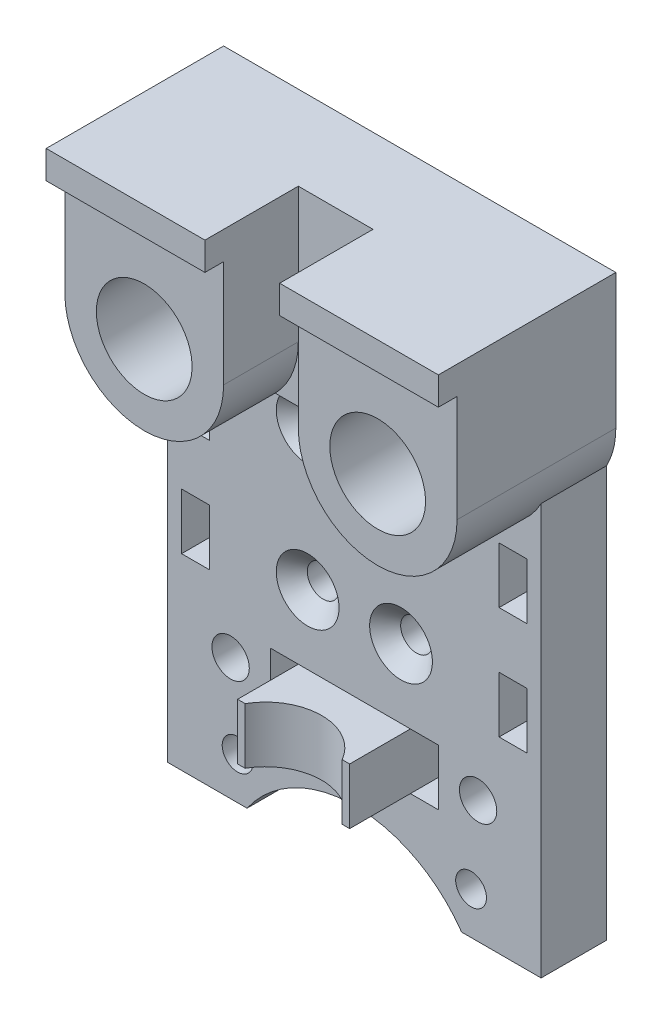
from build123d import *
from build123d.topology import SkipClean

# Parameters (mm, degrees)
SKETCH1_W                         = 30
SKETCH1_H                         = 42
BOSS_EXTRUDE1_DEPTH               = 7
CSK_FOR_M3_SFHCS1_D               = 3.4
CSK_FOR_M3_SFHCS1_CSINK_D         = 6.72
CSK_FOR_M3_SFHCS1_CSINK_ANGLE     = 90
SKETCH4_R                         = 14
CUT_EXTRUDE1_DEPTH                = 10
M4X0_7_TAPPED_HOLE1_D             = 3.3
SKETCH8_W                         = 12
SKETCH8_H                         = 6
BOSS_EXTRUDE2_DEPTH               = 6.5
SKETCH9_R                         = 6
CUT_EXTRUDE2_DEPTH                = 10
SKETCH13_W                        = 3
SKETCH13_H                        = 6
CUT_EXTRUDE4_DEPTH                = 10
BOSS_EXTRUDE5_DEPTH               = 10
BOSS_EXTRUDE5_DEPTH_BACK          = 7
SKETCH14_W                        = 48
SKETCH14_H                        = 17
SKETCH15_R                        = 5.125
CUT_EXTRUDE5_DEPTH                = 52.273774973
BOSS_EXTRUDE6_REACH               = 53.274
SKETCH16_R                        = 8.5
SKETCH16_R_2                      = 5.125
SKETCH18_R                        = 5.75
SKETCH18_R_2                      = 1.75
BOSS_EXTRUDE7_DEPTH               = 6.5
SKETCH19_R                        = 1.75
CUT_EXTRUDE6_DEPTH                = 17
SKETCH20_W                        = 32
SKETCH20_H                        = 3
BOSS_EXTRUDE8_DEPTH               = 3
CUT_EXTRUDE7_DEPTH                = 8
CUT_EXTRUDE7_DEPTH_BACK           = 8
SKETCH22_R                        = 1.75
SKETCH22_W                        = 8
SKETCH22_H                        = 3
SKETCH24_W                        = 2
SKETCH24_H                        = 7.001
F_4_0_4_DIAMETER_HOLE1_AT_2_COUNT = 2
F_4_0_4_DIAMETER_HOLE1_AT_2_PITCH = 26.5
CUT_EXTRUDE8_DEPTH                = 17
MOVE_FACE2_BY                     = 0.43
SKETCH26_W                        = 32
SKETCH26_H                        = 3.43
CUT_EXTRUDE9_DEPTH                = 3
BOSS_EXTRUDE9_DEPTH               = 3
DELETEFACE1_START                 = -7
DELETEFACE1_DEPTH                 = 7
SKETCH28_W                        = 3
SKETCH28_H                        = 6
CUT_EXTRUDE10_DEPTH               = 49.859492425


# Read off the part's stored shape, not the designer's step: DeleteFace1
with BuildPart() as part:
    # Sketch1 → Boss-Extrude1 (new body)
    with BuildSketch(Plane.XY):
        with Locations((0, -21)):
            Rectangle(SKETCH1_W, SKETCH1_H)
        Polygon((-15, -42), (-15, -2), (-20, -7), (-20, -42), align=None)
        Polygon((15, -2), (15, -42), (20, -42), (20, -7), align=None)
    extrude(amount=-BOSS_EXTRUDE1_DEPTH)

    # CSK for M3 SFHCS1 (through all)
    with Locations(Plane.XY):
        with Locations((-5, -3.5), (5, -3.5), (-5, -18.5), (5, -18.5)):
            CounterSinkHole(CSK_FOR_M3_SFHCS1_D / 2, CSK_FOR_M3_SFHCS1_CSINK_D / 2, counter_sink_angle=CSK_FOR_M3_SFHCS1_CSINK_ANGLE)

    # Sketch4 → Cut-Extrude1 (cut)
    with BuildSketch(Plane.XY):
        with Locations((0, -50)):
            Circle(SKETCH4_R)
    extrude(amount=-CUT_EXTRUDE1_DEPTH, mode=Mode.SUBTRACT)

    # M4x0.7 Tapped Hole1 (through all)
    with Locations(Plane.XY):
        with Locations((-12.5, -37.5), (12.5, -37.5)):
            Hole(M4X0_7_TAPPED_HOLE1_D / 2)

    # Sketch8 → Boss-Extrude2 (add)
    with BuildSketch(Plane.XY):
        with Locations((0, -28.9)):
            Rectangle(SKETCH8_W, SKETCH8_H)
    extrude(amount=BOSS_EXTRUDE2_DEPTH)

    # Sketch9 → Cut-Extrude2 (cut)
    with BuildSketch(Plane(origin=(0, -25.9, 0), x_dir=(1, 0, 0), z_dir=(0, 1, 0))):
        with Locations((0, -9.5)):
            Circle(SKETCH9_R)
    extrude(amount=-CUT_EXTRUDE2_DEPTH, mode=Mode.SUBTRACT)

    # Sketch13 → Cut-Extrude4 (cut)
    with BuildSketch(Plane.XY):
        with Locations((-7.5, -28.9)):
            Rectangle(SKETCH13_W, SKETCH13_H)
        with Locations((7.5, -28.9)):
            Rectangle(SKETCH13_W, SKETCH13_H)
    extrude(amount=-CUT_EXTRUDE4_DEPTH, mode=Mode.SUBTRACT)

    # Sketch14 → Boss-Extrude5 (add, two sides: drawn at the far end of the back side and taken through both)
    with BuildSketch(Plane.XY.offset(-BOSS_EXTRUDE5_DEPTH_BACK)):
        with Locations((0, 8.5)):
            Rectangle(SKETCH14_W, SKETCH14_H)
    extrude(amount=BOSS_EXTRUDE5_DEPTH + BOSS_EXTRUDE5_DEPTH_BACK)

    # Sketch15 → Cut-Extrude5 (cut, through all)
    with BuildSketch(Plane(origin=(0, 0, -7), x_dir=(-1, 0, 0), z_dir=(0, 0, -1))):
        with Locations((12.5, 6)):
            Circle(SKETCH15_R)
        with Locations((-12.5, 6)):
            Circle(SKETCH15_R)
    extrude(amount=-CUT_EXTRUDE5_DEPTH, mode=Mode.SUBTRACT)

    # Boss-Extrude6: up to this face of the body (flat: up to its plane)
    boss_extrude6_end = Plane(part.part.faces().sort_by_distance((0, -11.103380249, -7))[0])
    # Sketch16 → Boss-Extrude6 (add, up to the picked face)
    with BuildSketch(Plane.XY.offset(10), mode=Mode.PRIVATE) as boss_extrude6_sk1:
        with Locations((-12.5, 6)):
            Circle(SKETCH16_R)
        with Locations(Location((-12.5, 6, 0), (0, 0, 180))):
            Circle(SKETCH16_R_2, mode=Mode.SUBTRACT)
    boss_extrude6_tool1 = split(extrude(boss_extrude6_sk1.sketch, amount=-BOSS_EXTRUDE6_REACH, mode=Mode.PRIVATE), bisect_by=boss_extrude6_end, keep=Keep.BOTH, mode=Mode.PRIVATE)
    # Sketch16 → Boss-Extrude6 (add, up to the picked face)
    with BuildSketch(Plane.XY.offset(10), mode=Mode.PRIVATE) as boss_extrude6_sk2:
        with Locations((12.5, 6)):
            Circle(SKETCH16_R)
        with Locations(Location((12.5, 6, 0), (0, 0, 180))):
            Circle(SKETCH16_R_2, mode=Mode.SUBTRACT)
    boss_extrude6_tool2 = split(extrude(boss_extrude6_sk2.sketch, amount=-BOSS_EXTRUDE6_REACH, mode=Mode.PRIVATE), bisect_by=boss_extrude6_end, keep=Keep.BOTH, mode=Mode.PRIVATE)
    add(boss_extrude6_tool1.solids().sort_by(Axis((-20.759584, 6, 10), (0, 0, -1)))[0])
    add(boss_extrude6_tool2.solids().sort_by(Axis((4.240416, 6, 10), (0, 0, -1)))[0])

    # Sketch19 → Cut-Extrude6 (cut)
    with BuildSketch(Plane(origin=(0, 0, -7), x_dir=(-1, 0, 0), z_dir=(0, 0, -1))):
        with Locations(Location((0, 5.25, 0), (0, 0, 180))):
            Circle(SKETCH19_R)
    extrude(amount=-CUT_EXTRUDE6_DEPTH, mode=Mode.SUBTRACT)

    # Sketch20 → Boss-Extrude8 (add)
    with BuildSketch(Plane.XY.offset(10)):
        with Locations((0, 15.5)):
            Rectangle(SKETCH20_W, SKETCH20_H)
    extrude(amount=BOSS_EXTRUDE8_DEPTH)

    # Sketch22 → Cut-Extrude7 (cut, two sides: drawn at the far end of the back side and taken through both)
    # profile 1 of 4: a face of its own
    with SkipClean():  # the faces are left unmerged after this step: merging them gives an invalid solid
        with BuildSketch(Plane.XY.offset(10).offset(-CUT_EXTRUDE7_DEPTH_BACK)):
            Polygon((-4, 6), (-4, 0), (4, 0), (4, 6), (4, 14), (-4, 14), align=None)
            with Locations((0, 5.25)):
                Circle(SKETCH22_R, mode=Mode.SUBTRACT)
        # profile 2 of 4: a face of its own
        with BuildSketch(Plane.XY.offset(10).offset(-CUT_EXTRUDE7_DEPTH_BACK)):
            with BuildLine():
                Line((-6.479202711, 0), (-4, 0))
                Line((-4, 0), (-4, 6))
                ThreePointArc((-4, 6), (-4.644213058, 2.753985287), (-6.479202711, 0))
            make_face()
        # profile 3 of 4: a face of its own
        with BuildSketch(Plane.XY.offset(10).offset(-CUT_EXTRUDE7_DEPTH_BACK)):
            with BuildLine():
                Line((4, 6), (4, 0))
                Line((4, 0), (6.479202711, 0))
                ThreePointArc((6.479202711, 0), (4.644213058, 2.753985287), (4, 6))
            make_face()
        # profile 4 of 4: a face of its own
        with BuildSketch(Plane.XY.offset(10).offset(-CUT_EXTRUDE7_DEPTH_BACK)):
            with Locations((0, 15.5)):
                Rectangle(SKETCH22_W, SKETCH22_H)
        extrude(amount=CUT_EXTRUDE7_DEPTH + CUT_EXTRUDE7_DEPTH_BACK, mode=Mode.SUBTRACT)

    # Sketch24 → Ø4.0 (4) Diameter Hole1 (revolve, cut)
    with SkipClean():  # the faces are left unmerged after this step: merging them gives an invalid solid
        with BuildSketch(Plane(origin=(13.25, -28.9, -7), x_dir=(0, 1, 0), z_dir=(1, 0, 0))):
            with Locations((1, 3.5005)):
                Rectangle(SKETCH24_W, SKETCH24_H)
        f_4_0_4_diameter_hole1 = revolve(axis=Axis((13.25, -28.9, -13.35), (0, 0, 1)), mode=Mode.SUBTRACT)

    # Ø4.0 (4) Diameter Hole1 at 2: Ø4.0 (4) Diameter Hole1 ×2
    with SkipClean():  # the faces are left unmerged after this step: merging them gives an invalid solid
        with Locations(*[(-i * F_4_0_4_DIAMETER_HOLE1_AT_2_PITCH, 0, 0) for i in range(1, F_4_0_4_DIAMETER_HOLE1_AT_2_COUNT)]):
            add(f_4_0_4_diameter_hole1, mode=Mode.SUBTRACT)

    # Sketch25 → Cut-Extrude8 (cut)
    with SkipClean():  # the faces are left unmerged after this step: merging them gives an invalid solid
        with BuildSketch(Plane.XY.offset(10)):
            with BuildLine():
                ThreePointArc((-18.520797289, 0), (-20.355786942, 2.753985287), (-21, 6))
                Line((-21, 6), (-21, 17))
                Line((-21, 17), (-24, 17))
                Line((-24, 17), (-24, 0))
                Line((-24, 0), (-18.520797289, 0))
            make_face()
            with BuildLine():
                ThreePointArc((21, 6), (20.355786942, 2.753985287), (18.520797289, 0))
                Line((18.520797289, 0), (24, 0))
                Line((24, 0), (24, 17))
                Line((24, 17), (21, 17))
                Line((21, 17), (21, 6))
            make_face()
        extrude(amount=-CUT_EXTRUDE8_DEPTH, mode=Mode.SUBTRACT)

    # Move Face2: a face moved outward by 0.43
    extrude(part.faces().sort_by_distance((0, 17, -2))[0], amount=MOVE_FACE2_BY, dir=(0, 1, 0))

    # Sketch26 → Cut-Extrude9 (cut)
    with SkipClean():  # the faces are left unmerged after this step: merging them gives an invalid solid
        with BuildSketch(Plane.XY.offset(13)):
            with Locations((0, 15.715)):
                Rectangle(SKETCH26_W, SKETCH26_H)
        extrude(amount=-CUT_EXTRUDE9_DEPTH, mode=Mode.SUBTRACT)

    # Sketch27 → Boss-Extrude9 (add)
    with SkipClean():  # the faces are left unmerged after this step: merging them gives an invalid solid
        with BuildSketch(Plane(origin=(0, 17.43, 0), x_dir=(1, 0, 0), z_dir=(0, 1, 0))):
            Polygon((-21, -10), (-21, -12), (-4, -12), (-4, -10), (-4, -2), (4, -2), (4, -10), (4, -12), (21, -12), (21, -10), (21, 7), (-21, 7), align=None)
        extrude(amount=BOSS_EXTRUDE9_DEPTH)

    # DeleteFace1 outline → DeleteFace1 (add)
    with SkipClean():  # the faces are left unmerged after this step: merging them gives an invalid solid
        with BuildSketch(Plane.XY.offset(DELETEFACE1_START)):
            with BuildLine():
                ThreePointArc((-15.094389582, -2.094389582), (-17.946575233, -0.525704424), (-20, 2))
                Line((-20, 2), (-20, -7))
                Line((-20, -7), (-15.094389582, -2.094389582))
            make_face()
            with BuildLine():
                Line((20, -7), (20, 2))
                ThreePointArc((20, 2), (17.946575233, -0.525704424), (15.094389582, -2.094389582))
                Line((15.094389582, -2.094389582), (20, -7))
            make_face()
        extrude(amount=DELETEFACE1_DEPTH)

    # Sketch28 → Cut-Extrude10 (cut, through all)
    with SkipClean():  # the faces are left unmerged after this step: merging them gives an invalid solid
        with BuildSketch(Plane.XY):
            with Locations((17, -18.9)):
                Rectangle(SKETCH28_W, SKETCH28_H)
            with Locations((17, -6.9)):
                Rectangle(SKETCH28_W, SKETCH28_H)
            with Locations((-17, -6.9)):
                Rectangle(SKETCH28_W, SKETCH28_H)
            with Locations((-17, -18.9)):
                Rectangle(SKETCH28_W, SKETCH28_H)
        extrude(amount=-CUT_EXTRUDE10_DEPTH, mode=Mode.SUBTRACT)


with BuildPart() as body_2:
    # Sketch18 → Boss-Extrude7 (new body)
    with BuildSketch(Plane(origin=(0, 0, -7), x_dir=(-1, 0, 0), z_dir=(0, 0, -1))):
        with Locations(Location((0, 5.25, 0), (0, 0, 180))):
            Circle(SKETCH18_R)
        with Locations(Location((0, 5.25, 0), (0, 0, 180))):
            Circle(SKETCH18_R_2, mode=Mode.SUBTRACT)
    extrude(amount=BOSS_EXTRUDE7_DEPTH)


solid = Compound([part.part, body_2.part])
